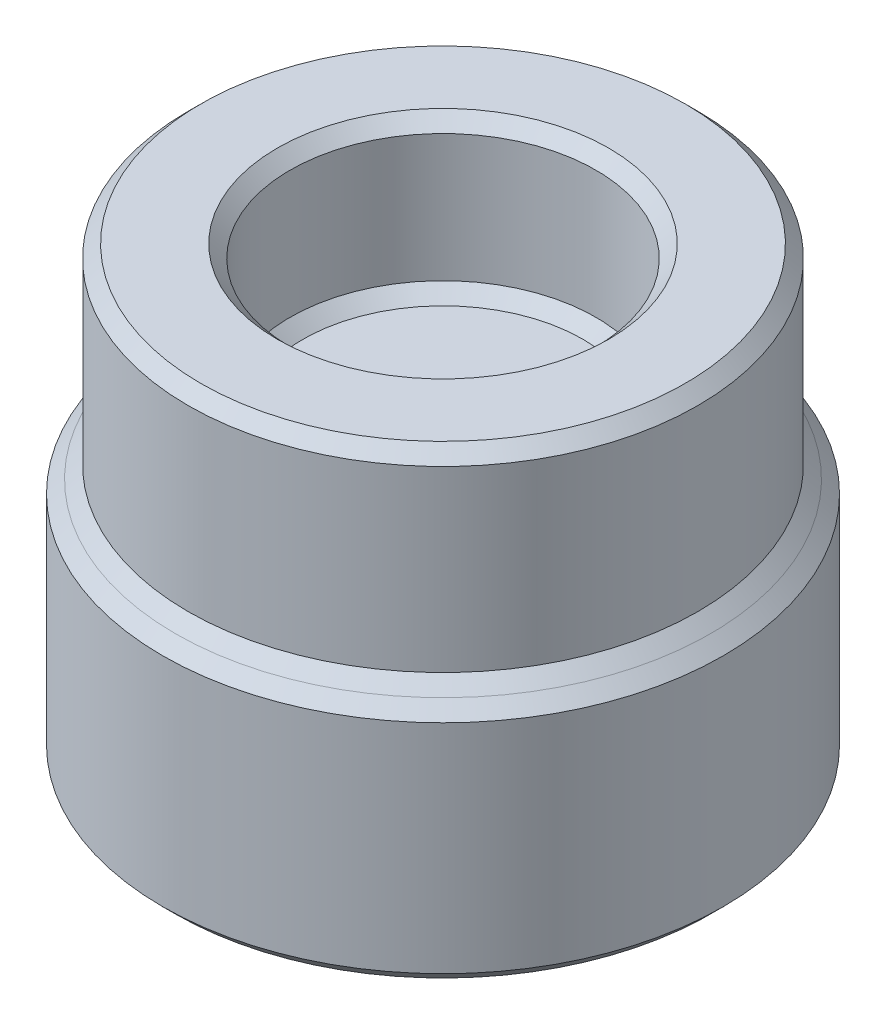
from build123d import *

# Parameters (mm, degrees)
SKETCH1_R                            = 5
SKETCH1_R_2                          = 3
BOSS_EXTRUDE1_DEPTH                  = 1
SKETCH1_3_R                          = 5
SKETCH1_3_R_2                        = 3
BOSS_EXTRUDE2_DEPTH                  = 4
CHAMFER1_SIZE                        = 0.25
SKETCH5_R                            = 5.5
BOSS_EXTRUDE4_DEPTH                  = 4.7625
F_2_0_221_DIAMETER_HOLE1_D           = 5.6134
F_2_0_221_DIAMETER_HOLE1_DEPTH       = 4.265103063
F_2_0_221_DIAMETER_HOLE1_CSINK_D     = 6.8834
F_2_0_221_DIAMETER_HOLE1_CSINK_ANGLE = 90
F_2_0_221_DIAMETER_HOLE1_TIP         = 0.494896937
CHAMFER2_SIZE                        = 0.25
CHAMFER3_SIZE                        = 0.25


with BuildPart() as part:
    # Sketch1 → Boss-Extrude1 (new body)
    # profile 1 of 2: a face of its own
    with BuildSketch(Plane(origin=(0, 0, 0), x_dir=(1, 0, 0), z_dir=(0, 1, 0))):
        with Locations(Location((0, 0, 0), (0, 0, 270))):
            Circle(SKETCH1_R)
        Circle(SKETCH1_R_2, mode=Mode.SUBTRACT)
    # profile 2 of 2: a face of its own
    with BuildSketch(Plane(origin=(0, 0, 0), x_dir=(1, 0, 0), z_dir=(0, 1, 0))):
        Circle(SKETCH1_R_2)
    extrude(amount=BOSS_EXTRUDE1_DEPTH)

    # Sketch1<3> → Boss-Extrude2 (add)
    with BuildSketch(Plane(origin=(0, 0, 0), x_dir=(1, 0, 0), z_dir=(0, 1, 0))):
        with Locations(Location((0, 0, 0), (0, 0, 270))):
            Circle(SKETCH1_3_R)
        with Locations(Location((0, 0, 0), (0, 0, 270))):
            Circle(SKETCH1_3_R_2, mode=Mode.SUBTRACT)
    extrude(amount=BOSS_EXTRUDE2_DEPTH)

    # Chamfer1
    chamfer1_edges = [part.edges().sort_by_distance(p)[0] for p in [
        (0, 1, -3),
        (0, 4, -5),
        (0, 4, -3),
    ]]
    chamfer(chamfer1_edges, length=CHAMFER1_SIZE)

    # Sketch5 → Boss-Extrude4 (add)
    with BuildSketch(Plane(origin=(0, 0, 0), x_dir=(1, 0, 0), z_dir=(0, 1, 0))):
        with Locations(Location((0, 0, 0), (0, 0, 270))):
            Circle(SKETCH5_R)
    extrude(amount=-BOSS_EXTRUDE4_DEPTH)

    # #2 (0.221) Diameter Hole1
    with Locations(Plane(origin=(0, -4.7625, 0), x_dir=(-1, 0, 0), z_dir=(0, -1, 0))):
        with Locations((0, 0)):
            CounterSinkHole(F_2_0_221_DIAMETER_HOLE1_D / 2, F_2_0_221_DIAMETER_HOLE1_CSINK_D / 2, depth=F_2_0_221_DIAMETER_HOLE1_DEPTH, counter_sink_angle=F_2_0_221_DIAMETER_HOLE1_CSINK_ANGLE)
            with Locations((0, 0, -(F_2_0_221_DIAMETER_HOLE1_DEPTH + F_2_0_221_DIAMETER_HOLE1_TIP / 2))):  # 160° drill point
                Cone(0, F_2_0_221_DIAMETER_HOLE1_D / 2, F_2_0_221_DIAMETER_HOLE1_TIP, mode=Mode.SUBTRACT)

    # Chamfer2
    chamfer2_edges = [part.edges().sort_by_distance(p)[0] for p in [
        (0, -4.7625, -5.5),
        (0, 0, -5.5),
    ]]
    chamfer(chamfer2_edges, length=CHAMFER2_SIZE)

    # Chamfer3
    chamfer3_edges = [part.edges().sort_by_distance(p)[0] for p in [
        (0, 0, -5),
    ]]
    chamfer(chamfer3_edges, length=CHAMFER3_SIZE - 0.0001)  # a hair under: the kernel refuses the full size


solid = part.part
